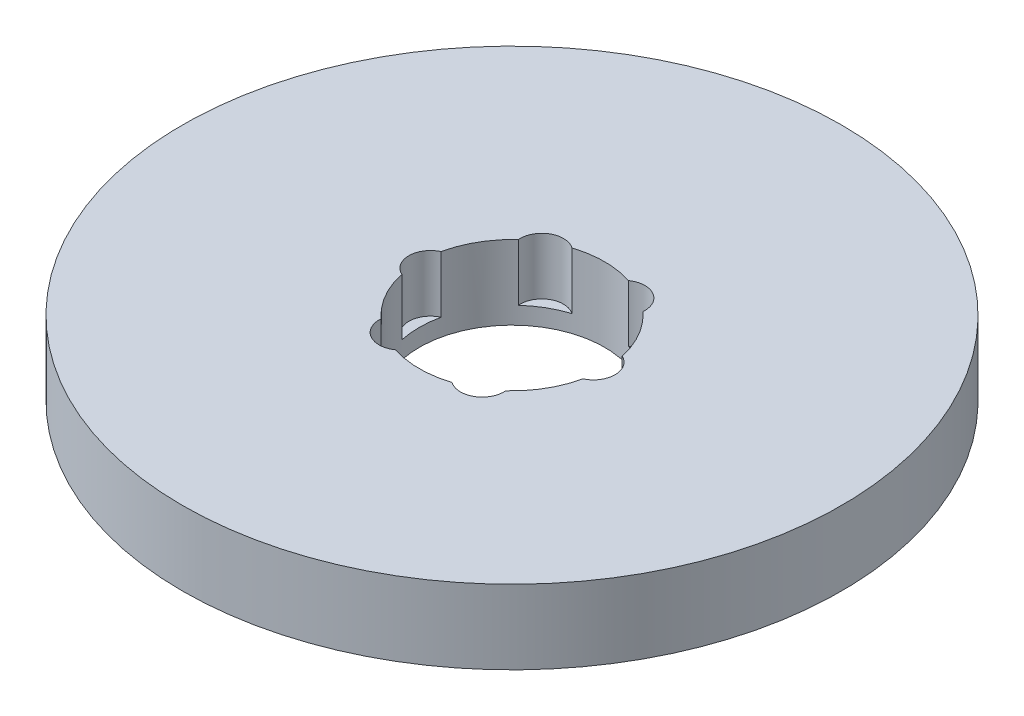
from build123d import *

# Parameters (mm, degrees)
SKETCH1_R           = 80
BOSS_EXTRUDE1_DEPTH = 18
SKETCH2_R           = 22.5
CUT_EXTRUDE1_DEPTH  = 115.560027933
SKETCH3_R           = 5.258573241
CUT_EXTRUDE2_DEPTH  = 13.805886004
CIRPATTERN1_COUNT   = 6


with BuildPart() as part:
    # Sketch1 → Boss-Extrude1 (new body)
    with BuildSketch(Plane(origin=(0, 0, 0), x_dir=(1, 0, 0), z_dir=(0, 1, 0))):
        Circle(SKETCH1_R)
    extrude(amount=BOSS_EXTRUDE1_DEPTH)

    # Sketch2 → Cut-Extrude1 (cut, through all)
    with BuildSketch(Plane(origin=(0, 0, 0), x_dir=(1, 0, 0), z_dir=(0, 1, 0))):
        Circle(SKETCH2_R)
    extrude(amount=CUT_EXTRUDE1_DEPTH, mode=Mode.SUBTRACT)

    # Sketch3 → Cut-Extrude2 (cut)
    with BuildSketch(Plane(origin=(0, 18, 0), x_dir=(1, 0, 0), z_dir=(0, 1, 0))):
        with Locations((-19.771531564, 0)):
            Circle(SKETCH3_R)
    cut_extrude2 = extrude(amount=-CUT_EXTRUDE2_DEPTH, mode=Mode.SUBTRACT)

    # CirPattern1: Cut-Extrude2 ×6 about axis
    cirpattern1_axis = Axis((0, 0, 0), (0, 1, 0))
    for i in range(1, CIRPATTERN1_COUNT):
        add(cut_extrude2.rotate(cirpattern1_axis, i * 360 / CIRPATTERN1_COUNT), mode=Mode.SUBTRACT)


solid = part.part
